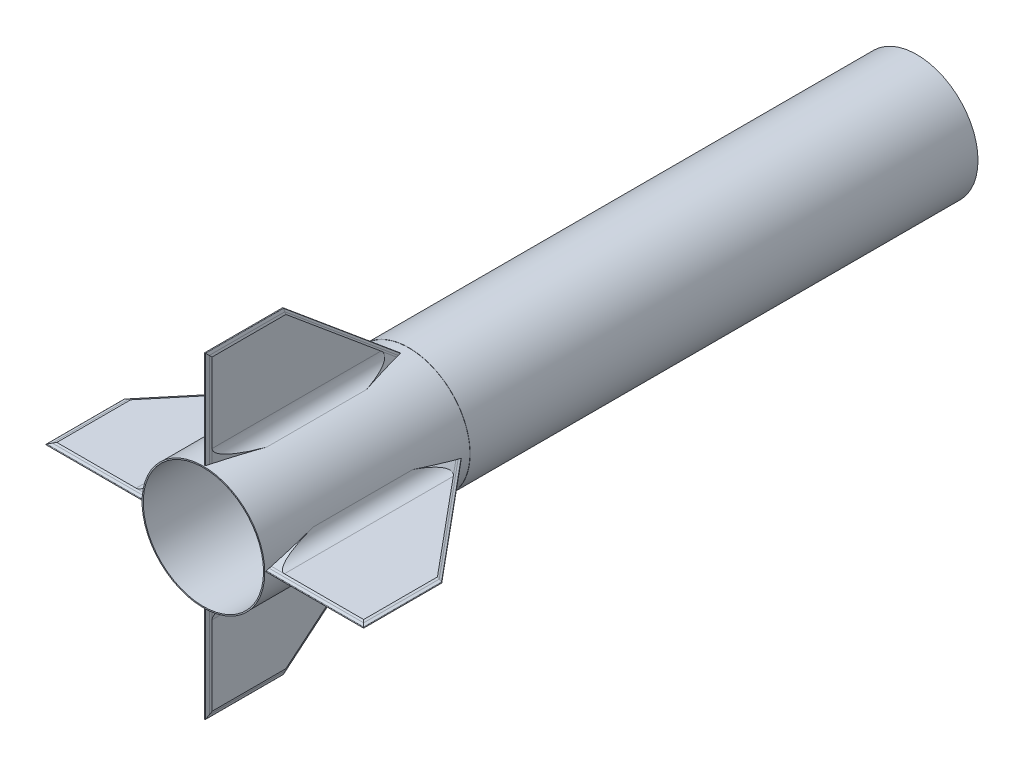
from build123d import *

# Parameters (mm, degrees)
FINBODY_DEPTH            = 3.175
CARBONFIBERX5_DEPTH      = 0.762
CUT_EXTRUDE1_START       = 61.317316812
CUT_EXTRUDE1_OUTLINE_W   = 136
CUT_EXTRUDE1_OUTLINE_H   = 159
CUT_EXTRUDE1_DEPTH       = 2.682683188
CUT_EXTRUDE1_START_2     = 64.24612394
CUT_EXTRUDE1_2_OUTLINE_W = 137
CUT_EXTRUDE1_2_OUTLINE_H = 159
CUT_EXTRUDE1_2_DEPTH     = 2.75387606
CUT_EXTRUDE1_START_3     = -196
CUT_EXTRUDE1_3_DEPTH     = 277.303418757
CUT_EXTRUDE4_DEPTH       = 283.382778156
CUT_EXTRUDE4_DEPTH_BACK  = 283.382778156
CUT_EXTRUDE5_DEPTH       = 282.569624531
CUT_EXTRUDE5_DEPTH_BACK  = 282.569624531
SKETCH13_R               = 78.36
SKETCH13_R_2             = 77.09
BOSS_EXTRUDE1_DEPTH      = 914.4
BOSS_EXTRUDE2_REACH      = 933.171
BOSS_EXTRUDE3_START      = -112.051714554
BOSS_EXTRUDE3_DEPTH      = 127.80631156
BOSS_EXTRUDE3_START_2    = -245.273823745
BOSS_EXTRUDE3_2_DEPTH    = 236.505370373
BOSS_EXTRUDE3_START_3    = -130
BOSS_EXTRUDE3_3_DEPTH    = 140
CIRPATTERN1_COUNT        = 4
SKETCH18_W               = 519.548726742
SKETCH18_H               = 439.659397243
CUT_EXTRUDE6_DEPTH       = 651
SKETCH17_R               = 78.614
SKETCH17_R_2             = 78.36
SKETCH17_R_3             = 77.09
BOSS_EXTRUDE4_DEPTH      = 0.1
SKETCH19_R               = 78.614
SKETCH19_R_2             = 77.09
BOSS_EXTRUDE5_DEPTH      = 0.1
SKETCH20_R               = 78.36
SKETCH20_R_2             = 77.09
BOSS_EXTRUDE6_DEPTH      = 914.4
SKETCH21_W               = 490.676006992
SKETCH21_H               = 455.150743556
CUT_EXTRUDE7_DEPTH       = 263.4


with BuildPart() as part:
    # Sketch1 → FinBody (new body)
    with BuildSketch(Plane(origin=(0, 0, 0), x_dir=(1, 0, 0), z_dir=(0, 1, 0))):
        Polygon((0, 0), (0, 254), (127, 101.6), (127, 0), align=None)
    extrude(amount=FINBODY_DEPTH)

    # Cut-Extrude1 3 outline → Cut-Extrude1 3 (cut)
    with BuildSketch(Plane(origin=(0, 0, 0), x_dir=(0.7682212795973759, 0, -0.6401843996644799), z_dir=(0.6401843996644799, 0, 0.7682212795973759)).offset(CUT_EXTRUDE1_START_3)):
        with BuildLine():
            Line((158.813981394, 3.175), (161.141390442, 2.2008629))
            add(Edge.make_bspline(
                [(161.141390442, 2.2008629), (161.44269317, 2.074752637), (161.44269317, 1.5875), (161.44269317, 1.100247363), (161.141390442, 0.9741371)],
                knots=[1.832595715, 1.832595715, 1.832595715, 3.141592654, 3.141592654, 4.450589593, 4.450589593, 4.450589593], degree=2, weights=[1, 0.79335334, 1, 0.79335334, 1]))
            Line((161.141390442, 0.9741371), (158.813981394, 0))
            Line((158.813981394, 0), (162.606837515, 0))
            Line((162.606837515, 0), (162.606837515, 3.175))
            Line((162.606837515, 3.175), (158.813981394, 3.175))
        make_face()
    extrude(amount=CUT_EXTRUDE1_3_DEPTH, mode=Mode.SUBTRACT)


with BuildPart() as body_2:
    # Sketch2 → CarbonFiberx5 (new body)
    with BuildSketch(Plane(origin=(0, 3.175, 0), x_dir=(1, 0, 0), z_dir=(0, 1, 0))):
        Polygon((0, 0), (127, 0), (127, 101.6), (0, 254), align=None)
    extrude(amount=CARBONFIBERX5_DEPTH)


with BuildPart() as body_3:
    # Mirror2: mirrored copy
    add(body_2.part.mirror(Plane.ZX.offset(1.5875)))

    # Cut-Extrude1: read off the stored shape, not the designer's step
    # Cut-Extrude1 outline → Cut-Extrude1 (cut)
    with BuildSketch(Plane(origin=(0, 0, 0), x_dir=(0.9549997658332683, 0.2864999297499726, 0.0767674248080761), z_dir=(0.2966065529593081, -0.9224589379183683, -0.2471721274660901)).offset(CUT_EXTRUDE1_START)):
        with Locations((47, -167.5)):
            Rectangle(CUT_EXTRUDE1_OUTLINE_W, CUT_EXTRUDE1_OUTLINE_H)
    extrude(amount=CUT_EXTRUDE1_DEPTH, mode=Mode.SUBTRACT)


with BuildPart() as body_2_1:
    add(body_2.part)

    # Cut-Extrude1 2 outline → Cut-Extrude1 2 (cut)
    with BuildSketch(Plane(origin=(0, 0, 0), x_dir=(0.9549997658332683, -0.2864999297499725, 0.07676742480807609), z_dir=(0.29660655295930805, 0.9224589379183683, -0.2471721274660901)).offset(CUT_EXTRUDE1_START_2)):
        with Locations((46.5, 166.5)):
            Rectangle(CUT_EXTRUDE1_2_OUTLINE_W, CUT_EXTRUDE1_2_OUTLINE_H)
    extrude(amount=CUT_EXTRUDE1_2_DEPTH, mode=Mode.SUBTRACT)


with BuildPart() as cut_extrude4_tool:
    # Sketch11 → Cut-Extrude4 (new, two sides: drawn at the far end of the back side and taken through both)
    with BuildSketch(Plane.XY.offset(-CUT_EXTRUDE4_DEPTH_BACK)):
        with BuildLine():
            Line((121.075369343, 3.175), (124.710898495, 2.2008629))
            ThreePointArc((124.710898495, 2.2008629), (125.181548401, 1.5875), (124.710898495, 0.9741371))
            Line((124.710898495, 0.9741371), (121.075369343, 0))
            Line((121.075369343, 0), (127, 0))
            Line((127, 0), (127, 3.175))
            Line((127, 3.175), (121.075369343, 3.175))
        make_face()
        Polygon((118.231546628, 3.937), (121.075369343, 3.175), (127, 3.175), (127, 3.937), align=None)
        Polygon((127, 0), (121.075369343, 0), (118.231546628, -0.762), (127, -0.762), align=None)
    extrude(amount=CUT_EXTRUDE4_DEPTH + CUT_EXTRUDE4_DEPTH_BACK)


with BuildPart() as part_1:
    add(part.part)

    # Cut-Extrude4: cut by cut_extrude4_tool
    add(cut_extrude4_tool.part, mode=Mode.SUBTRACT)


with BuildPart() as body_2_2:
    add(body_2_1.part)

    # Cut-Extrude4: cut by cut_extrude4_tool
    add(cut_extrude4_tool.part, mode=Mode.SUBTRACT)


with BuildPart() as body_3_1:
    add(body_3.part)

    # Cut-Extrude4: cut by cut_extrude4_tool
    add(cut_extrude4_tool.part, mode=Mode.SUBTRACT)


with BuildPart() as cut_extrude5_tool:
    # Sketch12 → Cut-Extrude5 (new, two sides: drawn at the far end of the back side and taken through both)
    with BuildSketch(Plane.ZY.offset(-CUT_EXTRUDE5_DEPTH_BACK)):
        with BuildLine():
            Line((-5.924630657, 3.175), (-2.289101505, 2.2008629))
            ThreePointArc((-2.289101505, 2.2008629), (-1.818451599, 1.5875), (-2.289101505, 0.9741371))
            Line((-2.289101505, 0.9741371), (-5.924630657, 0))
            Line((-5.924630657, 0), (0, 0))
            Line((0, 0), (0, 3.175))
            Line((0, 3.175), (-5.924630657, 3.175))
        make_face()
        Polygon((-8.768453372, 3.937), (-5.924630657, 3.175), (0, 3.175), (0, 3.937), align=None)
        Polygon((0, 0), (-5.924630657, 0), (-8.768453372, -0.762), (0, -0.762), align=None)
    extrude(amount=CUT_EXTRUDE5_DEPTH + CUT_EXTRUDE5_DEPTH_BACK)


with BuildPart() as part_2:
    add(part_1.part)

    # Cut-Extrude5: cut by cut_extrude5_tool
    add(cut_extrude5_tool.part, mode=Mode.SUBTRACT)



with BuildPart() as body_2_3:
    add(body_2_2.part)

    # Cut-Extrude5: cut by cut_extrude5_tool
    add(cut_extrude5_tool.part, mode=Mode.SUBTRACT)


with BuildPart() as body_3_2:
    add(body_3_1.part)

    # Cut-Extrude5: cut by cut_extrude5_tool
    add(cut_extrude5_tool.part, mode=Mode.SUBTRACT)


with BuildPart() as body_4:
    # Sketch13 → Boss-Extrude1 (new body)
    with BuildSketch(Plane.XY):
        with Locations((-78.36, 1.5875)):
            Circle(SKETCH13_R)
        with Locations((-78.36, 1.5875)):
            Circle(SKETCH13_R_2, mode=Mode.SUBTRACT)
    extrude(amount=-BOSS_EXTRUDE1_DEPTH)


with BuildPart() as part_3:
    add(part_2.part)

    # Boss-Extrude2: up to this face of the body
    boss_extrude2_end = body_4.part.faces().sort_by_distance((-156.72, 1.5875, -457.2))[0]
    # Sketch14 → Boss-Extrude2 (add, up to the picked face)
    with BuildSketch(Plane.ZY, mode=Mode.PRIVATE) as boss_extrude2_sk1:
        with BuildLine():
            ThreePointArc((-2.289101505, 0.9741371), (-1.818451599, 1.5875), (-2.289101505, 2.2008629))
            Line((-2.289101505, 2.2008629), (-5.924630657, 3.175))
            Line((-5.924630657, 3.175), (-248.075369343, 3.175))
            Line((-248.075369343, 3.175), (-251.710898495, 2.2008629))
            ThreePointArc((-251.710898495, 2.2008629), (-252.181548401, 1.5875), (-251.710898495, 0.9741371))
            Line((-251.710898495, 0.9741371), (-248.075369343, 0))
            Line((-248.075369343, 0), (-5.924630657, 0))
            Line((-5.924630657, 0), (-2.289101505, 0.9741371))
        make_face()
    boss_extrude2_tool1 = split(extrude(boss_extrude2_sk1.sketch, amount=BOSS_EXTRUDE2_REACH, mode=Mode.PRIVATE), bisect_by=boss_extrude2_end, keep=Keep.BOTH, mode=Mode.PRIVATE)
    # Sketch14 → Boss-Extrude2 (add, up to the picked face)
    with BuildSketch(Plane.ZY, mode=Mode.PRIVATE) as boss_extrude2_sk2:
        Polygon((-248.075369343, 3.175), (-5.924630657, 3.175), (-8.768453372, 3.937), (-245.231546628, 3.937), align=None)
    boss_extrude2_tool2 = split(extrude(boss_extrude2_sk2.sketch, amount=BOSS_EXTRUDE2_REACH, mode=Mode.PRIVATE), bisect_by=boss_extrude2_end, keep=Keep.BOTH, mode=Mode.PRIVATE)
    # Sketch14 → Boss-Extrude2 (add, up to the picked face)
    with BuildSketch(Plane.ZY, mode=Mode.PRIVATE) as boss_extrude2_sk3:
        Polygon((-8.768453372, -0.762), (-5.924630657, 0), (-248.075369343, 0), (-245.231546628, -0.762), align=None)
    boss_extrude2_tool3 = split(extrude(boss_extrude2_sk3.sketch, amount=BOSS_EXTRUDE2_REACH, mode=Mode.PRIVATE), bisect_by=boss_extrude2_end, keep=Keep.BOTH, mode=Mode.PRIVATE)
    add(boss_extrude2_tool1.solids().sort_by(Axis((0, 1.5875, -127), (-1, 0, 0)))[0])
    add(boss_extrude2_tool1.solids().sort_by(Axis((0, 1.5875, -127), (-1, 0, 0)))[1])
    add(boss_extrude2_tool2.solids().sort_by(Axis((0, 3.554491, -127), (-1, 0, 0)))[0])
    add(boss_extrude2_tool3.solids().sort_by(Axis((0, -0.379491, -127), (-1, 0, 0)))[0])


with BuildPart() as body_5:
    # Boss-Extrude3: read off the stored shape, not the designer's step
    # Boss-Extrude3 outline → Boss-Extrude3 (new body)
    with BuildSketch(Plane.XY.offset(-80).offset(BOSS_EXTRUDE3_START)):
        with BuildLine():
            Line((-0.035230931, 3.937), (16.670360937, 3.937))
            ThreePointArc((16.670360937, 3.937), (4.771236529, 8.110396277), (-1.914264624, 18.80200385))
            ThreePointArc((-1.914264624, 18.80200385), (-0.618638123, 11.414516514), (-0.035230931, 3.937))
        make_face()
    extrude(amount=BOSS_EXTRUDE3_DEPTH)

    # Boss-Extrude3 2 outline → Boss-Extrude3 2 (add)
    with BuildSketch(Plane.XY.offset(BOSS_EXTRUDE3_START_2)):
        with BuildLine():
            Line((-0.035230931, 3.937), (16.670360937, 3.937))
            ThreePointArc((16.670360937, 3.937), (4.771236529, 8.110396277), (-1.914264624, 18.80200385))
            ThreePointArc((-1.914264624, 18.80200385), (-0.618638123, 11.414516514), (-0.035230931, 3.937))
        make_face()
    extrude(amount=BOSS_EXTRUDE3_2_DEPTH)

    # Boss-Extrude3 3 outline → Boss-Extrude3 3 (cut)
    with BuildSketch(Plane(origin=(0, 0, 0), x_dir=(0.5276547533232092, 0.21985614721800906, -0.8205143117739485), z_dir=(0.8494589226651417, -0.1365670993989199, 0.5096753535990756)).offset(BOSS_EXTRUDE3_START_3)):
        Polygon((7, 1.533407249), (112.03594442, 1.533407249), (89.279853505, 17), (7, 17), align=None)
        Polygon((212, 1.533407249), (112.03594442, 1.533407249), (160.704845691, -31.545300267), (202.097666569, -59.678686872), (204.041722519, -61), (212, -61), align=None)
    extrude(amount=BOSS_EXTRUDE3_3_DEPTH, mode=Mode.SUBTRACT)


with BuildPart() as body_6:
    # Mirror3: mirrored copy
    add(body_5.part.mirror(Plane.ZX.offset(1.5875)))


with BuildPart() as cirpattern1_1:
    # CirPattern1: pattern copy
    add(body_6.part.rotate(Axis((-78.36, 1.5875, -914.4), (0, 0, 1)), 1 * 360 / CIRPATTERN1_COUNT))


with BuildPart() as cirpattern1_2:
    # CirPattern1: pattern copy
    add(body_6.part.rotate(Axis((-78.36, 1.5875, -914.4), (0, 0, 1)), 2 * 360 / CIRPATTERN1_COUNT))


with BuildPart() as cirpattern1_3:
    # CirPattern1: pattern copy
    add(body_6.part.rotate(Axis((-78.36, 1.5875, -914.4), (0, 0, 1)), 3 * 360 / CIRPATTERN1_COUNT))


with BuildPart() as cirpattern1_4:
    # CirPattern1: pattern copy
    add(body_3_2.part.rotate(Axis((-78.36, 1.5875, -914.4), (0, 0, 1)), 1 * 360 / CIRPATTERN1_COUNT))


with BuildPart() as cirpattern1_5:
    # CirPattern1: pattern copy
    add(body_3_2.part.rotate(Axis((-78.36, 1.5875, -914.4), (0, 0, 1)), 2 * 360 / CIRPATTERN1_COUNT))


with BuildPart() as cirpattern1_6:
    # CirPattern1: pattern copy
    add(body_3_2.part.rotate(Axis((-78.36, 1.5875, -914.4), (0, 0, 1)), 3 * 360 / CIRPATTERN1_COUNT))


with BuildPart() as cirpattern1_7:
    # CirPattern1: pattern copy
    add(part_3.part.rotate(Axis((-78.36, 1.5875, -914.4), (0, 0, 1)), 1 * 360 / CIRPATTERN1_COUNT))


with BuildPart() as cirpattern1_8:
    # CirPattern1: pattern copy
    add(part_3.part.rotate(Axis((-78.36, 1.5875, -914.4), (0, 0, 1)), 2 * 360 / CIRPATTERN1_COUNT))


with BuildPart() as cirpattern1_9:
    # CirPattern1: pattern copy
    add(part_3.part.rotate(Axis((-78.36, 1.5875, -914.4), (0, 0, 1)), 3 * 360 / CIRPATTERN1_COUNT))


with BuildPart() as cirpattern1_10:
    # CirPattern1: pattern copy
    add(body_2_3.part.rotate(Axis((-78.36, 1.5875, -914.4), (0, 0, 1)), 1 * 360 / CIRPATTERN1_COUNT))


with BuildPart() as cirpattern1_11:
    # CirPattern1: pattern copy
    add(body_2_3.part.rotate(Axis((-78.36, 1.5875, -914.4), (0, 0, 1)), 2 * 360 / CIRPATTERN1_COUNT))


with BuildPart() as cirpattern1_12:
    # CirPattern1: pattern copy
    add(body_2_3.part.rotate(Axis((-78.36, 1.5875, -914.4), (0, 0, 1)), 3 * 360 / CIRPATTERN1_COUNT))


with BuildPart() as cirpattern1_13:
    # CirPattern1: pattern copy
    add(body_5.part.rotate(Axis((-78.36, 1.5875, -914.4), (0, 0, 1)), 1 * 360 / CIRPATTERN1_COUNT))


with BuildPart() as cirpattern1_14:
    # CirPattern1: pattern copy
    add(body_5.part.rotate(Axis((-78.36, 1.5875, -914.4), (0, 0, 1)), 2 * 360 / CIRPATTERN1_COUNT))


with BuildPart() as cirpattern1_15:
    # CirPattern1: pattern copy
    add(body_5.part.rotate(Axis((-78.36, 1.5875, -914.4), (0, 0, 1)), 3 * 360 / CIRPATTERN1_COUNT))


with BuildPart() as body_4_1:
    add(body_4.part)

    # Sketch18 → Cut-Extrude6 (cut)
    with BuildSketch(Plane(origin=(0, 0, -914.4), x_dir=(-1, 0, 0), z_dir=(0, 0, -1))):
        with Locations((83.18552997, 2.793882493)):
            Rectangle(SKETCH18_W, SKETCH18_H)
    extrude(amount=-CUT_EXTRUDE6_DEPTH, mode=Mode.SUBTRACT)

    # Sketch17 → Boss-Extrude4 (add)
    # profile 1 of 2: a face of its own
    with BuildSketch(Plane.XY):
        with Locations((-78.36, 1.5875)):
            Circle(SKETCH17_R)
        with Locations((-78.36, 1.5875)):
            Circle(SKETCH17_R_2, mode=Mode.SUBTRACT)
    # profile 2 of 2: a face of its own
    with BuildSketch(Plane.XY):
        with Locations((-78.36, 1.5875)):
            Circle(SKETCH17_R_2)
        with Locations((-78.36, 1.5875)):
            Circle(SKETCH17_R_3, mode=Mode.SUBTRACT)
    extrude(amount=-BOSS_EXTRUDE4_DEPTH)

    # Sketch19 → Boss-Extrude5 (add)
    with BuildSketch(Plane(origin=(0, 0, -263.4), x_dir=(-1, 0, 0), z_dir=(0, 0, -1))):
        with Locations(Location((78.36, 1.5875, 0), (0, 0, 180))):
            Circle(SKETCH19_R)
        with Locations(Location((78.36, 1.5875, 0), (0, 0, 180))):
            Circle(SKETCH19_R_2, mode=Mode.SUBTRACT)
    extrude(amount=-BOSS_EXTRUDE5_DEPTH)

    # Sketch20 → Boss-Extrude6 (add)
    with BuildSketch(Plane(origin=(0, 0, -263.4), x_dir=(-1, 0, 0), z_dir=(0, 0, -1))):
        with Locations(Location((78.36, 1.5875, 0), (0, 0, 180))):
            Circle(SKETCH20_R)
        with Locations(Location((78.36, 1.5875, 0), (0, 0, 180))):
            Circle(SKETCH20_R_2, mode=Mode.SUBTRACT)
    extrude(amount=BOSS_EXTRUDE6_DEPTH)

    # Sketch21 → Cut-Extrude7 (cut)
    with BuildSketch(Plane(origin=(0, 0, -1177.8), x_dir=(-1, 0, 0), z_dir=(0, 0, -1))):
        with Locations((78.493553622, -8.429021645)):
            Rectangle(SKETCH21_W, SKETCH21_H)
    extrude(amount=-CUT_EXTRUDE7_DEPTH, mode=Mode.SUBTRACT)


solid = Compound([body_2_3.part, body_3_2.part, part_3.part, body_5.part, body_6.part, cirpattern1_1.part, cirpattern1_2.part, cirpattern1_3.part, cirpattern1_4.part, cirpattern1_5.part, cirpattern1_6.part, cirpattern1_7.part, cirpattern1_8.part, cirpattern1_9.part, cirpattern1_10.part, cirpattern1_11.part, cirpattern1_12.part, cirpattern1_13.part, cirpattern1_14.part, cirpattern1_15.part, body_4_1.part])
